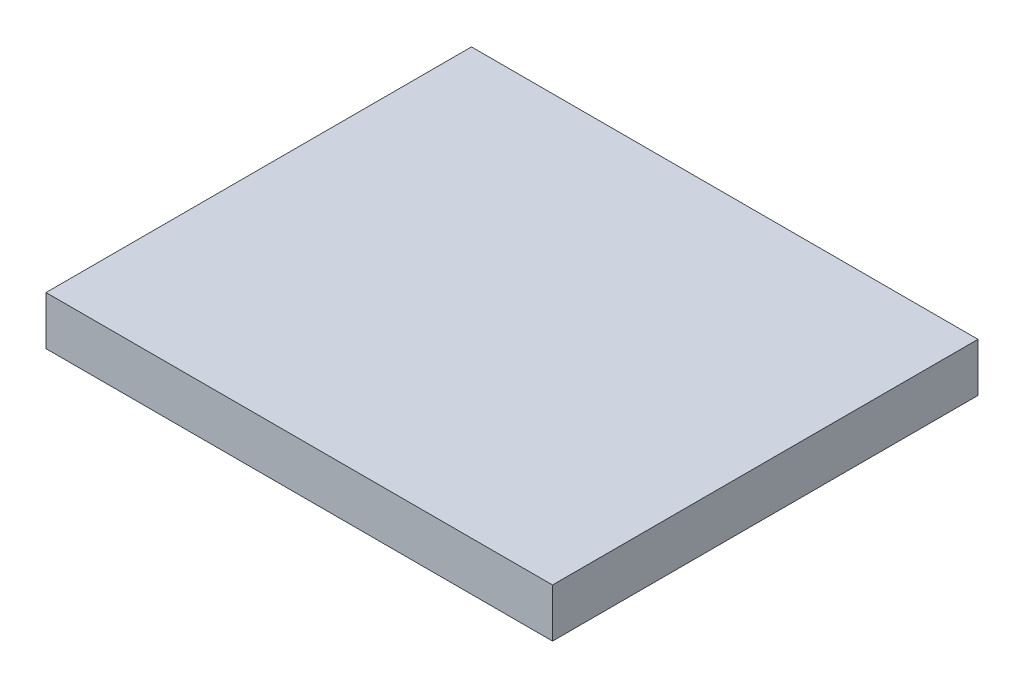
from build123d import *

# Parameters (mm, degrees)
SKETCH1_W               = 125
SKETCH1_H               = 105
TEST_BASE_POSTION_DEPTH = 12


with BuildPart() as part:
    # Sketch1 → Test_Base_Postion (new body)
    with BuildSketch(Plane(origin=(0, 0, 0), x_dir=(1, 0, 0), z_dir=(0, 1, 0))):
        Rectangle(SKETCH1_W, SKETCH1_H)
    extrude(amount=TEST_BASE_POSTION_DEPTH)


solid = part.part
